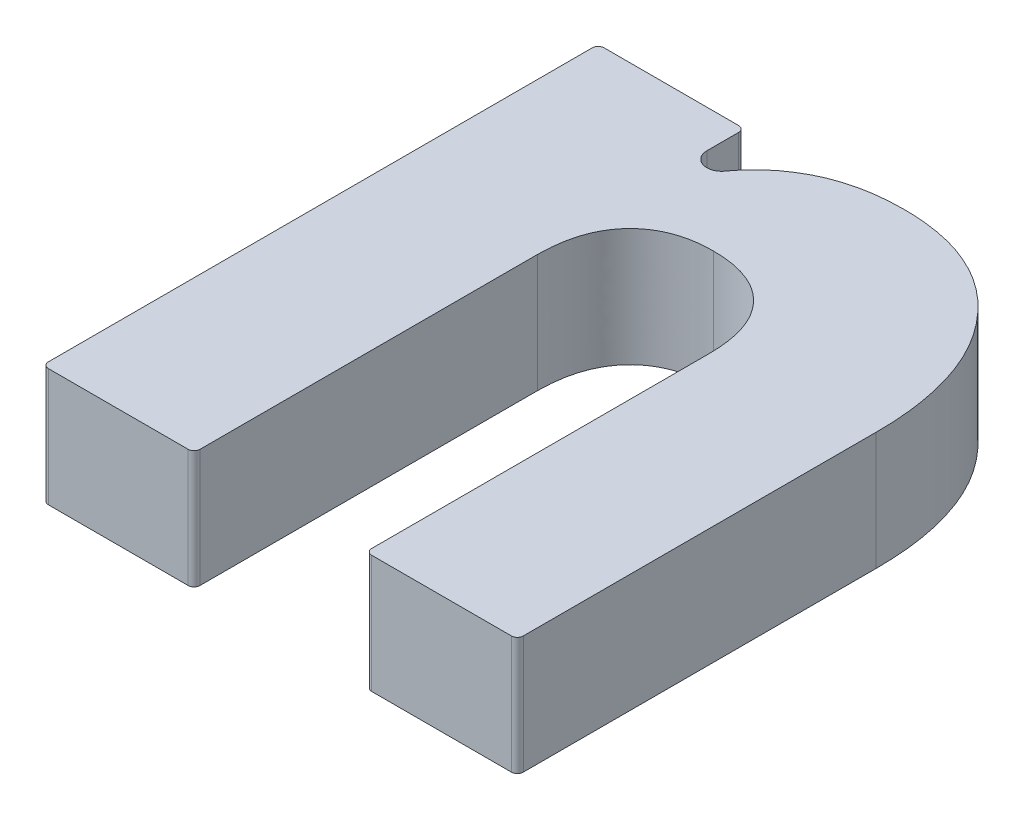
from build123d import *

# Parameters (mm, degrees)
BOSS_EXTRUDE4_DEPTH = 20
FILLET1_R           = 2.5
FILLET2_R           = 1


with BuildPart() as part:
    # Sketch1 → Boss-Extrude4 (new body)
    with BuildSketch(Plane(origin=(0, 0, 0), x_dir=(1, 0, 0), z_dir=(0, 1, 0))):
        with BuildLine():
            Line((11.2960761, 0), (11.2960761, 94.183511692))
            Line((11.2960761, 94.183511692), (36.117717004, 94.183511692))
            Line((36.117717004, 94.183511692), (36.118681602, 76.198969481))
            Line((36.118681602, 76.198969481), (36.118681602, 73.698206325))
            add(Edge.make_bspline(
                [(36.118681602, 73.698206325), (36.453965835, 75.287265535), (36.812480873, 77.741278883), (37.77900965, 80.900782065), (38.745269042, 83.182234182), (39.91840922, 85.31140742), (41.306060059, 87.280557165), (42.929706742, 89.055760223), (44.703921678, 90.681979972), (46.677001775, 92.056551683), (48.764665415, 93.263886973), (51.01662739, 94.238097997), (53.422874579, 94.964474713), (56.893531948, 95.724645381), (59.61323908, 95.893722751), (61.459571938, 95.892786365)],
                knots=[0, 0, 0, 0, 0.130484441, 0.19842009, 0.264656137, 0.329038707, 0.393226483, 0.45752369, 0.521820897, 0.586008673, 0.650138238, 0.71515577, 0.782457874, 0.851624156, 1, 1, 1, 1], degree=3))
            add(Edge.make_bspline(
                [(61.459571938, 95.892786365), (63.642747182, 95.89503988), (66.860373285, 95.622578842), (70.975616278, 94.619002713), (73.81918369, 93.546731264), (76.513216375, 92.201665064), (79.008955342, 90.527060718), (81.368727643, 88.586350735), (83.505998, 86.322153674), (85.456658827, 83.840238115), (87.157411129, 81.133469195), (88.597873392, 78.230438908), (89.755690467, 75.112673066), (90.676686162, 71.816121526), (91.545249312, 67.038385455), (91.796089943, 63.325985873), (91.780618312, 60.790725327)],
                knots=[0, 0, 0, 0, 0.125405885, 0.184535894, 0.242770712, 0.299619509, 0.357107795, 0.415044377, 0.474759331, 0.535579242, 0.596113657, 0.658053323, 0.721395479, 0.786875246, 0.85441502, 1, 1, 1, 1], degree=3))
            Line((91.780618312, 60.790725327), (91.780618312, 0))
            Line((91.780618312, 0), (66.091954023, 0))
            Line((66.091954023, 0), (66.091954023, 58.214427269))
            add(Edge.make_bspline(
                [(66.091954023, 58.214427269), (66.07859811, 60.407224075), (65.723544673, 63.62493637), (64.031064413, 67.396602881), (62.307555987, 69.646319752), (60.161707472, 71.454649846), (56.567334165, 73.211352686), (53.483041549, 73.648039875), (51.377328577, 73.622671423)],
                knots=[0, 0, 0, 0, 0.273114325, 0.393617609, 0.508303324, 0.621706566, 0.738475999, 1, 1, 1, 1], degree=3))
            add(Edge.make_bspline(
                [(51.377328577, 73.622671423), (49.317631232, 73.637200258), (46.28158005, 73.224773932), (42.782835215, 71.437456569), (40.665711566, 69.654030022), (38.999542578, 67.384832023), (37.331019098, 63.622458453), (37.017412139, 60.400983352), (36.984740388, 58.214427269)],
                knots=[0, 0, 0, 0, 0.259191055, 0.374425471, 0.488234098, 0.602886319, 0.724235001, 1, 1, 1, 1], degree=3))
            Line((36.984740388, 58.214427269), (36.984740388, 0))
            Line((36.984740388, 0), (11.2960761, 0))
        make_face()
    extrude(amount=-BOSS_EXTRUDE4_DEPTH)

    # Fillet1
    fillet1_edges = [part.edges().sort_by_distance(p)[0] for p in [
        (36.118681602, -10, -73.698206325),
    ]]
    fillet(fillet1_edges, radius=FILLET1_R)

    # Fillet2
    fillet2_edges = [part.edges().sort_by_distance(p)[0] for p in [
        (91.780618312, -10, 0),
        (66.091954023, -10, 0),
        (36.984740388, -10, 0),
        (11.2960761, -10, 0),
        (11.2960761, -10, -94.183511692),
        (36.117717004, -10, -94.183511692),
    ]]
    fillet(fillet2_edges, radius=FILLET2_R)


solid = part.part
